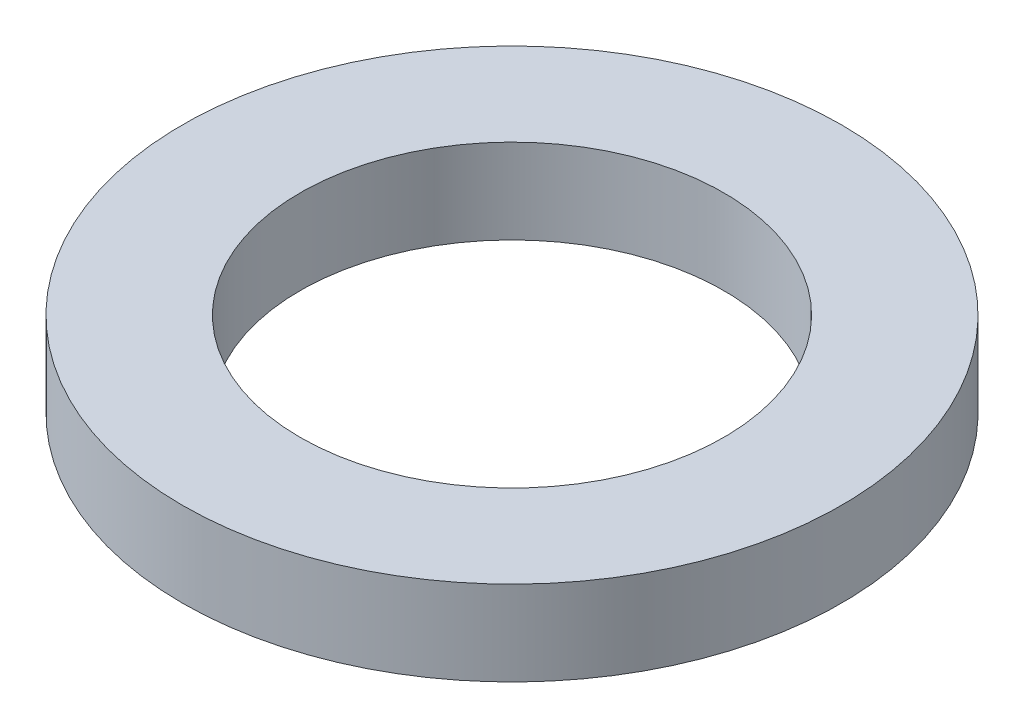
from build123d import *

# Parameters (mm, degrees)
SKETCH1_R           = 70
BOSS_EXTRUDE1_DEPTH = 18
SKETCH2_R           = 45
CUT_EXTRUDE1_DEPTH  = 101.618089825


with BuildPart() as part:
    # Sketch1 → Boss-Extrude1 (new body)
    with BuildSketch(Plane(origin=(0, 0, 0), x_dir=(1, 0, 0), z_dir=(0, 1, 0))):
        Circle(SKETCH1_R)
    extrude(amount=BOSS_EXTRUDE1_DEPTH)

    # Sketch2 → Cut-Extrude1 (cut, through all)
    with BuildSketch(Plane(origin=(0, 0, 0), x_dir=(1, 0, 0), z_dir=(0, 1, 0))):
        Circle(SKETCH2_R)
    extrude(amount=CUT_EXTRUDE1_DEPTH, mode=Mode.SUBTRACT)


solid = part.part
